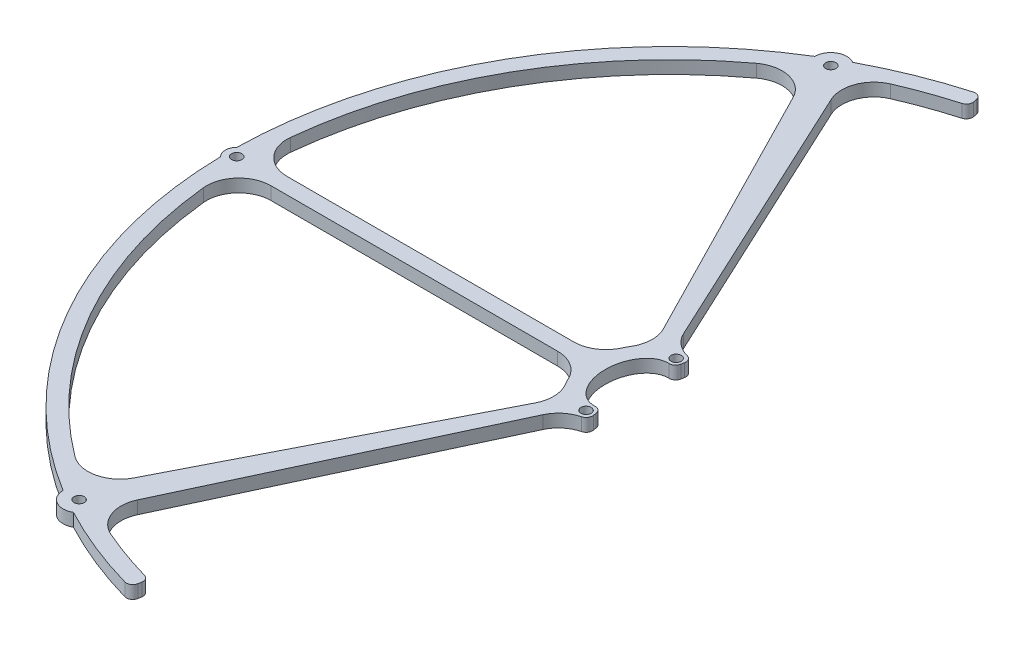
from build123d import *

# Parameters (mm, degrees)
BOSS_EXTRUDE1_DEPTH = 4
CUT_EXTRUDE1_REACH  = 23.383
SKETCH2_R           = 1.6
FILLET1_R           = 2
BOSS_EXTRUDE3_DEPTH = 4
FILLET2_R           = 2
CUT_EXTRUDE2_REACH  = 183.73
SKETCH5_R           = 1.6
SKETCH6_R           = 4.973451909
SKETCH6_R_2         = 1.6
SKETCH6_R_3         = 3.543914651
BOSS_EXTRUDE5_DEPTH = 4
FILLET3_DEPTH       = 4


with BuildPart() as part:
    # Sketch1 → Boss-Extrude1 (new body)
    with BuildSketch(Plane(origin=(0, 0, 0), x_dir=(1, 0, 0), z_dir=(0, 1, 0))):
        with BuildLine():
            Line((1.96560108, -11.147477671), (2.839162331, -16.101689713))
            add(Edge.make_bspline(
                [(2.839162331, 16.101689713), (-13, 20.600857242), (-13, 0), (-13, -20.600857242), (2.839162331, -16.101689713)],
                knots=[6.063013688, 6.063013688, 6.063013688, 7.853981634, 7.853981634, 9.64494958, 9.64494958, 9.64494958], degree=2, weights=[1, 0.625141143, 1, 0.625141143, 1]))
            Line((2.839162331, 16.101689713), (1.96560108, 11.147477671))
            add(Edge.make_bspline(
                [(1.96560108, 11.147477671), (-8, 14.778575721), (-8, 0), (-8, -14.778575721), (1.96560108, -11.147477671)],
                knots=[6.034943405, 6.034943405, 6.034943405, 7.853981634, 7.853981634, 9.673019863, 9.673019863, 9.673019863], degree=2, weights=[1, 0.614125339, 1, 0.614125339, 1]))
        make_face()
    extrude(amount=BOSS_EXTRUDE1_DEPTH)

    # Sketch2 → Cut-Extrude1 (cut, up to next)
    with BuildSketch(Plane(origin=(0, 4, 0), x_dir=(1, 0, 0), z_dir=(0, 1, 0)), mode=Mode.PRIVATE) as cut_extrude1_sk1:
        with Locations(Location((0, -14, 0), (0, 0, 270))):
            Circle(SKETCH2_R)
    cut_extrude1_tool1 = extrude(cut_extrude1_sk1.sketch, amount=-CUT_EXTRUDE1_REACH, mode=Mode.PRIVATE) & part.part
    cut_extrude1 = cut_extrude1_tool1.solids().sort_by_distance((0, 4, 14))[0]
    add(cut_extrude1, mode=Mode.SUBTRACT)

    # Mirror1: Cut-Extrude1 across plane
    add(cut_extrude1.mirror(Plane.XY), mode=Mode.SUBTRACT)

    # Fillet1
    fillet1_edges = [part.edges().sort_by_distance(p)[0] for p in [
        (2.839162331, 2, 16.101689713),
        (1.96560108, 2, 11.147477671),
        (1.96560108, 2, -11.147477671),
        (2.839162331, 2, -16.101689713),
    ]]
    fillet(fillet1_edges, radius=FILLET1_R)

    # Sketch3 → Boss-Extrude3 (add)
    with BuildSketch(Plane(origin=(0, 0, 0), x_dir=(1, 0, 0), z_dir=(0, 1, 0))):
        with BuildLine():
            Line((-6.879855744, -14), (-57.167121259, -112.427351373))
            ThreePointArc((-57.167121259, -112.427351373), (-53.486174981, -114.610474593), (-49.736392328, -116.673123993))
            Line((-49.736392328, -116.673123993), (-2.839162331, -16.101689713))
            Line((-2.839162331, -16.101689713), (-6.879855744, -14))
        make_face()
        with BuildLine():
            Line((-12.849914157, 2.5), (-119.976323634, 2.5))
            ThreePointArc((-119.976323634, 2.5), (-120, 0), (-119.976323634, -2.5))
            Line((-119.976323634, -2.5), (-12.849914157, -2.5))
            Line((-12.849914157, -2.5), (-12.849914157, 2.5))
        make_face()
        with BuildLine():
            Line((-23.339282285, 132.363647304), (-22.467669248, 127.420484133))
            ThreePointArc((-22.467669248, 127.420484133), (-120, 0), (-22.467669248, -127.420484133))
            Line((-22.467669248, -127.420484133), (-23.339282285, -132.363647304))
            ThreePointArc((-23.339282285, -132.363647304), (-125, 0), (-23.339282285, 132.363647304))
        make_face()
        with BuildLine():
            Line((-6.879855744, 14), (-57.167121259, 112.427351373))
            ThreePointArc((-57.167121259, 112.427351373), (-53.486174981, 114.610474593), (-49.736392328, 116.673123993))
            Line((-49.736392328, 116.673123993), (-2.839162331, 16.101689713))
            Line((-2.839162331, 16.101689713), (-6.879855744, 14))
        make_face()
    extrude(amount=BOSS_EXTRUDE3_DEPTH)

    # Fillet2
    fillet2_edges = [part.edges().sort_by_distance(p)[0] for p in [
        (-22.467669248, 2, -127.420484133),
        (-23.339282285, 2, -132.363647304),
        (-23.339282285, 2, 132.363647304),
        (-22.467669248, 2, 127.420484133),
    ]]
    fillet(fillet2_edges, radius=FILLET2_R)

    # Sketch5 → Cut-Extrude2 (cut, up to next)
    with BuildSketch(Plane(origin=(0, 4, 0), x_dir=(1, 0, 0), z_dir=(0, 1, 0)), mode=Mode.PRIVATE) as cut_extrude2_sk1:
        with Locations(Location((-54.709234353, -116.751009066, 0), (0, 0, 270))):
            Circle(SKETCH5_R)
    cut_extrude2_tool1 = extrude(cut_extrude2_sk1.sketch, amount=-CUT_EXTRUDE2_REACH, mode=Mode.PRIVATE) & part.part
    # Sketch5 → Cut-Extrude2 (cut, up to next)
    with BuildSketch(Plane(origin=(0, 4, 0), x_dir=(1, 0, 0), z_dir=(0, 1, 0)), mode=Mode.PRIVATE) as cut_extrude2_sk2:
        with Locations(Location((-122.488161817, 0, 0), (0, 0, 270))):
            Circle(SKETCH5_R)
    cut_extrude2_tool2 = extrude(cut_extrude2_sk2.sketch, amount=-CUT_EXTRUDE2_REACH, mode=Mode.PRIVATE) & part.part
    # Sketch5 → Cut-Extrude2 (cut, up to next)
    with BuildSketch(Plane(origin=(0, 4, 0), x_dir=(1, 0, 0), z_dir=(0, 1, 0)), mode=Mode.PRIVATE) as cut_extrude2_sk3:
        with Locations(Location((-54.709234353, 116.751009066, 0), (0, 0, 270))):
            Circle(SKETCH5_R)
    cut_extrude2_tool3 = extrude(cut_extrude2_sk3.sketch, amount=-CUT_EXTRUDE2_REACH, mode=Mode.PRIVATE) & part.part
    add(cut_extrude2_tool1.solids().sort_by_distance((-54.709234, 4, 116.751009))[0], mode=Mode.SUBTRACT)
    add(cut_extrude2_tool2.solids().sort_by_distance((-122.488162, 4, 0))[0], mode=Mode.SUBTRACT)
    add(cut_extrude2_tool3.solids().sort_by_distance((-54.709234, 4, -116.751009))[0], mode=Mode.SUBTRACT)

    # Sketch6 → Boss-Extrude5 (add)
    # profile 1 of 3: a face of its own
    with BuildSketch(Plane(origin=(0, 4, 0), x_dir=(1, 0, 0), z_dir=(0, 1, 0))):
        with Locations((-54.709234353, 116.751009066)):
            Circle(SKETCH6_R)
        with Locations(Location((-54.709234353, 116.751009066, 0), (0, 0, 270))):
            Circle(SKETCH6_R_2, mode=Mode.SUBTRACT)
    # profile 2 of 3: a face of its own
    with BuildSketch(Plane(origin=(0, 4, 0), x_dir=(1, 0, 0), z_dir=(0, 1, 0))):
        with Locations((-122.488161817, 0)):
            Circle(SKETCH6_R_3)
        with Locations(Location((-122.488161817, 0, 0), (0, 0, 270))):
            Circle(SKETCH6_R_2, mode=Mode.SUBTRACT)
    # profile 3 of 3: a face of its own
    with BuildSketch(Plane(origin=(0, 4, 0), x_dir=(1, 0, 0), z_dir=(0, 1, 0))):
        with Locations((-54.709234353, -116.751009066)):
            Circle(SKETCH6_R)
        with Locations(Location((-54.709234353, -116.751009066, 0), (0, 0, 270))):
            Circle(SKETCH6_R_2, mode=Mode.SUBTRACT)
    extrude(amount=-BOSS_EXTRUDE5_DEPTH)

    # Fillet3: read off the stored shape, not the designer's step
    # Fillet3 outline → Fillet3 (add)
    with BuildSketch(Plane(origin=(0, 0, 0), x_dir=(1, 0, 0), z_dir=(0, 1, 0))):
        with BuildLine():
            ThreePointArc((0.649735937, 16.479378869), (0.838556237, 16.458343844), (1.02452864, 16.419487141))
            ThreePointArc((1.02452864, 16.419487141), (-2.863626926, 18.412833737), (-5.530711648, 21.87373585))
            Line((-5.530711648, 21.87373585), (-2.839162331, 16.101689713))
            add(Edge.make_bspline(
                [(0.649735937, 16.479378869), (-1.114935355, 16.591462206), (-2.839162331, 16.101689713)],
                knots=[6.233184788, 6.233184788, 6.233184788, 6.503356926, 6.503356926, 6.503356926], degree=2, weights=[1, 0.990889743, 1]))
        make_face()
        with BuildLine():
            Line((-49.736392328, 116.673123993), (-45.561407522, 107.719840184))
            ThreePointArc((-45.561407522, 107.719840184), (-45.847320291, 115.495159883), (-40.473602574, 121.12192631))
            ThreePointArc((-40.473602574, 121.12192631), (-45.148304388, 118.987693925), (-49.736392328, 116.673123993))
        make_face()
        with BuildLine():
            Line((-2.839162331, -16.101689713), (-5.530711648, -21.87373585))
            ThreePointArc((-5.530711648, -21.87373585), (-2.863626926, -18.412833737), (1.02452864, -16.419487141))
            ThreePointArc((1.02452864, -16.419487141), (0.838556237, -16.458343844), (0.649735937, -16.479378869))
            add(Edge.make_bspline(
                [(-2.839162331, -16.101689713), (-1.114935355, -16.591462206), (0.649735937, -16.479378869)],
                knots=[2.921421035, 2.921421035, 2.921421035, 3.191593172, 3.191593172, 3.191593172], degree=2, weights=[1, 0.990889743, 1]))
        make_face()
        with BuildLine():
            ThreePointArc((-40.473602574, -121.12192631), (-45.847320291, -115.495159883), (-45.561407522, -107.719840184))
            Line((-45.561407522, -107.719840184), (-49.736392328, -116.673123993))
            ThreePointArc((-49.736392328, -116.673123993), (-45.148304388, -118.987693925), (-40.473602574, -121.12192631))
        make_face()
        with BuildLine():
            Line((-119.976323634, 2.5), (-109.357941644, 2.5))
            ThreePointArc((-109.357941644, 2.5), (-116.782424846, 5.800966549), (-119.30531391, 13.524590164))
            ThreePointArc((-119.30531391, 13.524590164), (-119.756178466, 8.019316429), (-119.976323634, 2.5))
        make_face()
        with BuildLine():
            ThreePointArc((-11.226140006, 8.320364892), (-14.916167472, 4.079894565), (-20.310778159, 2.5))
            Line((-20.310778159, 2.5), (-12.849914157, 2.5))
            add(Edge.make_bspline(
                [(-11.226140006, 8.320364892), (-12.474747939, 5.606455431), (-12.849914157, 2.5)],
                knots=[1.04144141, 1.04144141, 1.04144141, 1.418695385, 1.418695385, 1.418695385], degree=2, weights=[0.95507516, 0.96002058, 1]))
        make_face()
        with BuildLine():
            ThreePointArc((-57.167121259, 112.427351373), (-62.108944542, 109.233073466), (-66.903498293, 105.821727245))
            ThreePointArc((-66.903498293, 105.821727245), (-58.657069297, 107.544135675), (-52.020878816, 102.35460218))
            Line((-52.020878816, 102.35460218), (-57.167121259, 112.427351373))
        make_face()
        with BuildLine():
            ThreePointArc((-9.890368349, 19.892481504), (-8.802841791, 14.958387827), (-10.266227719, 10.122429179))
            add(Edge.make_bspline(
                [(-6.879855744, 14), (-8.845213681, 12.444127025), (-10.266227719, 10.122429179)],
                knots=[0.55768063, 0.55768063, 0.55768063, 0.911503254, 0.911503254, 0.911503254], degree=2, weights=[1, 0.962503713, 0.955824633]))
            Line((-6.879855744, 14), (-9.890368349, 19.892481504))
        make_face()
        with BuildLine():
            Line((-57.167121259, -112.427351373), (-52.020878816, -102.35460218))
            ThreePointArc((-52.020878816, -102.35460218), (-58.657069297, -107.544135675), (-66.903498293, -105.821727245))
            ThreePointArc((-66.903498293, -105.821727245), (-62.108944542, -109.233073466), (-57.167121259, -112.427351373))
        make_face()
        with BuildLine():
            ThreePointArc((-10.266227719, -10.122429179), (-8.802841791, -14.958387827), (-9.890368349, -19.892481504))
            Line((-9.890368349, -19.892481504), (-6.879855744, -14))
            add(Edge.make_bspline(
                [(-10.266227719, -10.122429179), (-8.845213681, -12.444127025), (-6.879855744, -14)],
                knots=[2.2300894, 2.2300894, 2.2300894, 2.583912024, 2.583912024, 2.583912024], degree=2, weights=[0.955824633, 0.962503713, 1]))
        make_face()
        with BuildLine():
            ThreePointArc((-119.976323634, -2.5), (-119.756178466, -8.019316429), (-119.305313909, -13.524590164))
            ThreePointArc((-119.305313909, -13.524590164), (-116.782424846, -5.800966549), (-109.357941644, -2.5))
            Line((-109.357941644, -2.5), (-119.976323634, -2.5))
        make_face()
        with BuildLine():
            ThreePointArc((-20.310778159, -2.5), (-14.916167472, -4.079894565), (-11.226140006, -8.320364892))
            add(Edge.make_bspline(
                [(-12.849914157, -2.5), (-12.474747939, -5.606455431), (-11.226140006, -8.320364892)],
                knots=[1.722897268, 1.722897268, 1.722897268, 2.100151243, 2.100151243, 2.100151243], degree=2, weights=[1, 0.96002058, 0.95507516]))
            Line((-12.849914157, -2.5), (-20.310778159, -2.5))
        make_face()
    extrude(amount=FILLET3_DEPTH)


solid = part.part
